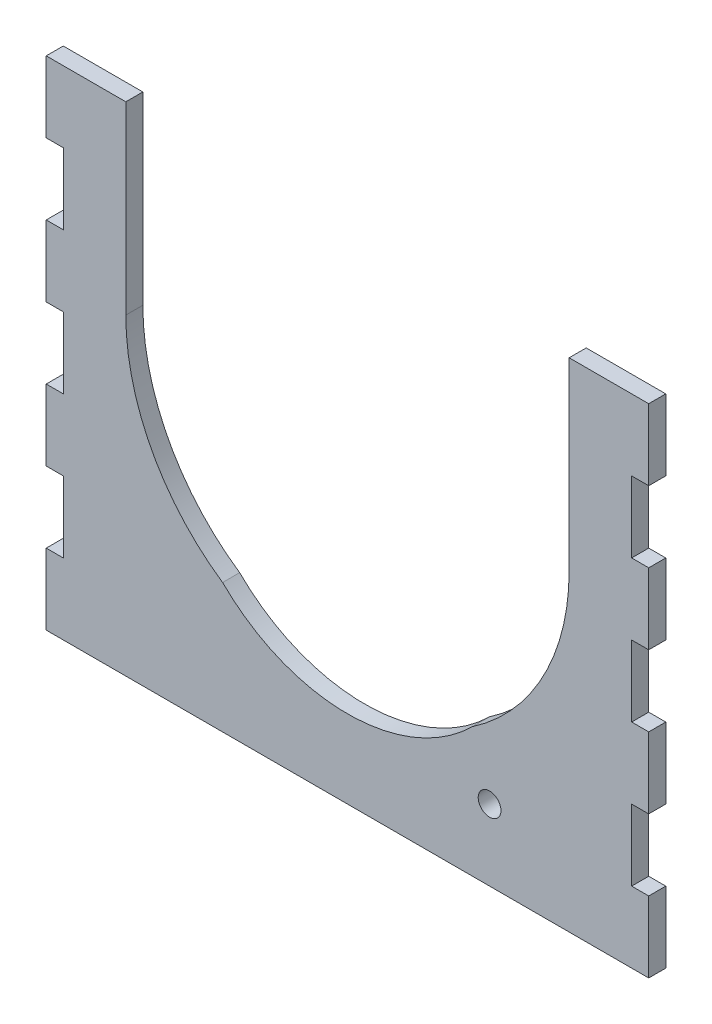
from build123d import *

# Parameters (mm, degrees)
BOSS_EXTRUDE1_DEPTH   = 6
SKETCH2_W             = 6
SKETCH2_H             = 25
BOSS_EXTRUDE2_DEPTH   = 6
LPATTERN1_OUTLINE_W   = 6
LPATTERN1_OUTLINE_H   = 6
LPATTERN1_DEPTH       = 25
LPATTERN1_START       = 50
LPATTERN1_2_OUTLINE_W = 6
LPATTERN1_2_OUTLINE_H = 6
LPATTERN1_2_DEPTH     = 25
LPATTERN1_START_2     = 100
LPATTERN1_3_OUTLINE_W = 6
LPATTERN1_3_OUTLINE_H = 6
LPATTERN1_3_DEPTH     = 25
LPATTERN1_START_3     = 150
LPATTERN1_4_OUTLINE_W = 6
LPATTERN1_4_OUTLINE_H = 6
LPATTERN1_4_DEPTH     = 25
SKETCH5_R             = 4
CUT_EXTRUDE1_DEPTH    = 271.364568685


# Read off the part's stored shape, not the designer's step: LPattern1
with BuildPart() as part:
    # Sketch1 → Boss-Extrude1 (new body)
    with BuildSketch(Plane.XY):
        with BuildLine():
            Line((-178, 175), (-200, 175))
            Line((-200, 175), (-200, 0))
            Line((-200, 0), (0, 0))
            Line((0, 0), (0, 175))
            Line((0, 175), (-22, 175))
            Line((-22, 175), (-22, 110))
            ThreePointArc((-22, 110), (-31.037807258, 73.555302549), (-56.056819802, 45.55625))
            ThreePointArc((-56.056819802, 45.55625), (-100, 27.5), (-143.943180198, 45.55625))
            ThreePointArc((-143.943180198, 45.55625), (-168.962192742, 73.555302549), (-178, 110))
            Line((-178, 110), (-178, 175))
        make_face()
    extrude(amount=BOSS_EXTRUDE1_DEPTH)

    # Sketch2 → Boss-Extrude2 (add)
    with BuildSketch(Plane.XY.offset(6)):
        with Locations((-203, 162.5)):
            Rectangle(SKETCH2_W, SKETCH2_H)
    extrude(amount=-BOSS_EXTRUDE2_DEPTH)

    # LPattern1 outline → LPattern1 (add)
    with BuildSketch(Plane(origin=(0, 0, 0), x_dir=(1, 0, 0), z_dir=(0, 1, 0))):
        with Locations((-203, -3)):
            Rectangle(LPATTERN1_OUTLINE_W, LPATTERN1_OUTLINE_H)
        with Locations((3, -3)):
            Rectangle(LPATTERN1_OUTLINE_W, LPATTERN1_OUTLINE_H)
    extrude(amount=LPATTERN1_DEPTH)

    # LPattern1 2 outline → LPattern1 2 (add)
    with BuildSketch(Plane(origin=(0, 0, 0), x_dir=(1, 0, 0), z_dir=(0, 1, 0)).offset(LPATTERN1_START)):
        with Locations((-203, -3)):
            Rectangle(LPATTERN1_2_OUTLINE_W, LPATTERN1_2_OUTLINE_H)
        with Locations((3, -3)):
            Rectangle(LPATTERN1_2_OUTLINE_W, LPATTERN1_2_OUTLINE_H)
    extrude(amount=LPATTERN1_2_DEPTH)

    # LPattern1 3 outline → LPattern1 3 (add)
    with BuildSketch(Plane(origin=(0, 0, 0), x_dir=(1, 0, 0), z_dir=(0, 1, 0)).offset(LPATTERN1_START_2)):
        with Locations((-203, -3)):
            Rectangle(LPATTERN1_3_OUTLINE_W, LPATTERN1_3_OUTLINE_H)
        with Locations((3, -3)):
            Rectangle(LPATTERN1_3_OUTLINE_W, LPATTERN1_3_OUTLINE_H)
    extrude(amount=LPATTERN1_3_DEPTH)

    # LPattern1 4 outline → LPattern1 4 (add)
    with BuildSketch(Plane(origin=(0, 0, 0), x_dir=(1, 0, 0), z_dir=(0, 1, 0)).offset(LPATTERN1_START_3)):
        with Locations((3, -3)):
            Rectangle(LPATTERN1_4_OUTLINE_W, LPATTERN1_4_OUTLINE_H)
    extrude(amount=LPATTERN1_4_DEPTH)

    # Sketch5 → Cut-Extrude1 (cut, through all)
    with BuildSketch(Plane.XY.offset(6)):
        with Locations((-50, 25)):
            Circle(SKETCH5_R)
    extrude(amount=-CUT_EXTRUDE1_DEPTH, mode=Mode.SUBTRACT)


solid = part.part
